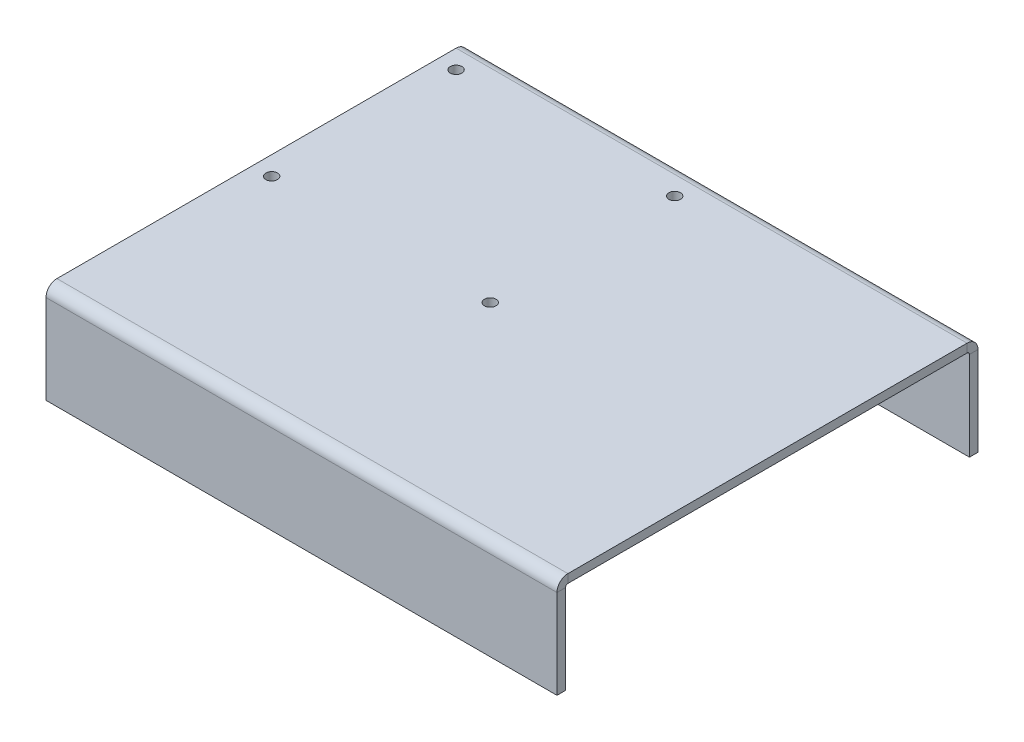
from build123d import *

# Parameters (mm, degrees)
SKETCH2_W                      = 190
SKETCH2_H                      = 150
BASE_FLANGE1_DEPTH             = 3.175
EDGE_FLANGE1_STRIP_W           = 14.578
EDGE_FLANGE1_STRIP_H           = 3.175
EDGE_FLANGE1_STRIP_CUT_DEPTH   = 190
EDGE_FLANGE1_STRIP_2_W         = 14.578
EDGE_FLANGE1_STRIP_2_H         = 3.175
EDGE_FLANGE1_STRIP_CUT_2_DEPTH = 190
EDGE_FLANGE1_DEPTH             = 190
EDGE_FLANGE1_BEND_DEPTH        = 190
F_6_CLEARANCE_HOLE1_D          = 4.3053
F_6_CLEARANCE_HOLE1_DEPTH      = 17.23
F_6_CLEARANCE_HOLE1_TIP        = 1.293442612


# Sheet-metal steps are written as plain solids
with BuildPart() as part:
    # Sketch2 → Base-Flange1 (new body)
    with BuildSketch(Plane(origin=(0, 0, 0), x_dir=(1, 0, 0), z_dir=(0, 1, 0))):
        Rectangle(SKETCH2_W, SKETCH2_H)
    extrude(amount=-BASE_FLANGE1_DEPTH)

    # Edge-Flange1 strip (across the edge) → Edge-Flange1 strip cut (cut)
    with BuildSketch(Plane(origin=(95, -3.175, 75.1), x_dir=(0, 0, -1), z_dir=(-1, 0, 0))):
        with Locations((-6.4, -1.5875)):
            Rectangle(EDGE_FLANGE1_STRIP_W, EDGE_FLANGE1_STRIP_H)
    extrude(amount=EDGE_FLANGE1_STRIP_CUT_DEPTH, mode=Mode.SUBTRACT)

    # Edge-Flange1 strip 2 (across the edge) → Edge-Flange1 strip cut 2 (cut)
    with BuildSketch(Plane(origin=(-95, -3.175, -75.1), x_dir=(0, 0, 1), z_dir=(1, 0, 0))):
        with Locations((-6.4, -1.5875)):
            Rectangle(EDGE_FLANGE1_STRIP_2_W, EDGE_FLANGE1_STRIP_2_H)
    extrude(amount=EDGE_FLANGE1_STRIP_CUT_2_DEPTH, mode=Mode.SUBTRACT)

    # Edge-Flange1 section (across the edge) → Edge-Flange1 (add)
    with BuildSketch(Plane(origin=(95, -3.175, 75.1), x_dir=(0, 0, -1), z_dir=(-1, 0, 0))):
        with BuildLine():
            Line((-3.175, 0.889), (-3.175, 34))
            Line((-3.175, 34), (0, 34))
            Line((0, 34), (0, 0.889))
            ThreePointArc((0, 0.889), (0.260382072, 0.260382072), (0.889, 0))
            Line((0.889, 0), (0.889, -3.175))
            ThreePointArc((0.889, -3.175), (-1.984681959, -1.984681959), (-3.175, 0.889))
        make_face()
    extrude(amount=EDGE_FLANGE1_DEPTH)

    # Edge-Flange1 section 2 (across the edge) → Edge-Flange1 bend (add)
    with BuildSketch(Plane(origin=(-95, -3.175, -75.1), x_dir=(0, 0, 1), z_dir=(1, 0, 0))):
        with BuildLine():
            Line((-3.175, 0.889), (-3.175, 34))
            Line((-3.175, 34), (0, 34))
            Line((0, 34), (0, 0.889))
            ThreePointArc((0, 0.889), (0.260382072, 0.260382072), (0.889, 0))
            Line((0.889, 0), (0.889, -3.175))
            ThreePointArc((0.889, -3.175), (-1.984681959, -1.984681959), (-3.175, 0.889))
        make_face()
    extrude(amount=EDGE_FLANGE1_BEND_DEPTH)

    # #6 Clearance Hole1
    with Locations(Plane(origin=(0, 0, 0), x_dir=(1, 0, 0), z_dir=(0, 1, 0))):
        with Locations((-88.015, 67.226), (-6.735, 67.226), (-6.735, -1.354), (-88.015, -1.354)):
            Hole(F_6_CLEARANCE_HOLE1_D / 2, depth=F_6_CLEARANCE_HOLE1_DEPTH)
            with Locations((0, 0, -(F_6_CLEARANCE_HOLE1_DEPTH + F_6_CLEARANCE_HOLE1_TIP / 2))):  # 118° drill point
                Cone(0, F_6_CLEARANCE_HOLE1_D / 2, F_6_CLEARANCE_HOLE1_TIP, mode=Mode.SUBTRACT)


solid = part.part
